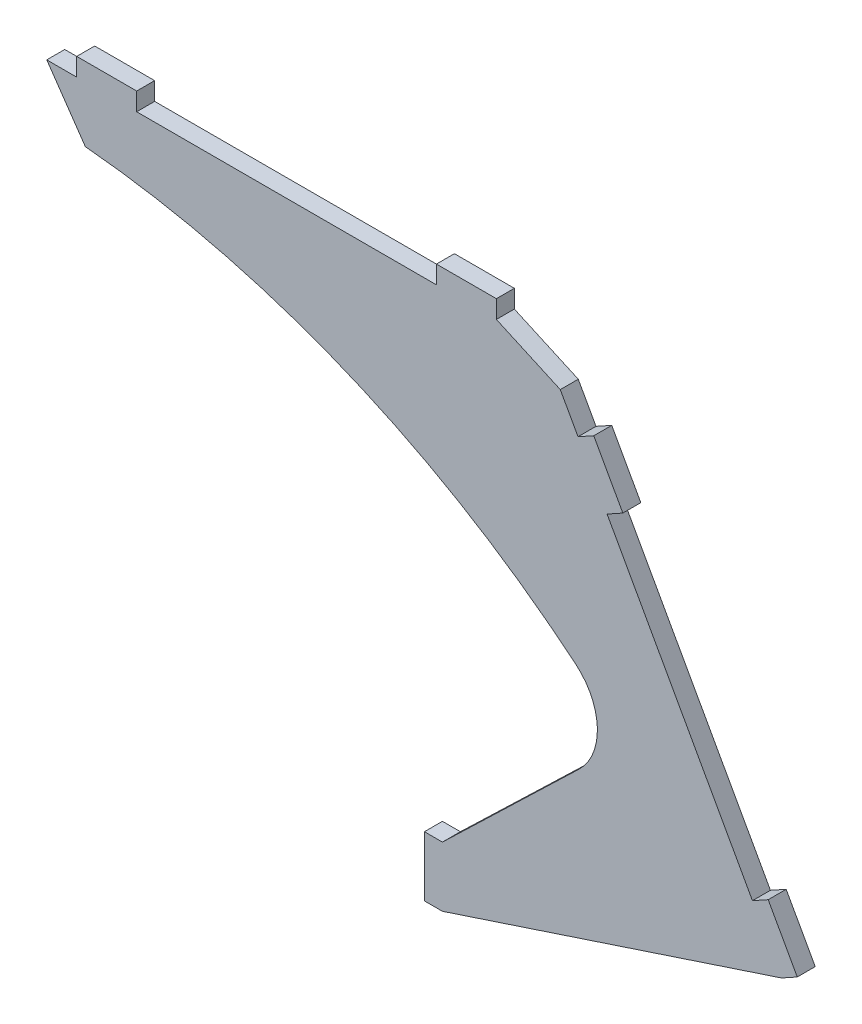
from build123d import *

# Parameters (mm, degrees)
DODANIE_WYCI_GNI_CIE1_DEPTH = 3


with BuildPart() as part:
    # Szkic1 → Dodanie-wyciągnięcie1 (new body)
    with BuildSketch(Plane.XY):
        with BuildLine():
            Line((19.554515356, 17.692448485), (42.339037775, 39.614393428))
            ThreePointArc((42.339037775, 39.614393428), (45.398922839, 47.188413696), (41.790456431, 54.516964018))
            ThreePointArc((41.790456431, 54.516964018), (3.452713921, 77.627149658), (-40.003066725, 88.3723025))
            Line((-40.003066725, 88.3723025), (-46.445484644, 97.692448485))
            Line((-46.445484644, 97.692448485), (-41.445484644, 97.692448485))
            Line((-41.445484644, 97.692448485), (-41.445484644, 100.692448485))
            Line((-41.445484644, 100.692448485), (-31.445484644, 100.692448485))
            Line((-31.445484644, 100.692448485), (-31.445484644, 97.692448485))
            Line((-31.445484644, 97.692448485), (18.554515356, 97.692448485))
            Line((18.554515356, 97.692448485), (18.554515356, 100.692448485))
            Line((18.554515356, 100.692448485), (28.554515356, 100.692448485))
            Line((28.554515356, 100.692448485), (28.554515356, 97.692448485))
            Line((28.554515356, 97.692448485), (39.21740232, 92.890521172))
            Line((39.21740232, 92.890521172), (42.174065347, 87.558833747))
            Line((42.174065347, 87.558833747), (44.797661434, 89.013737032))
            Line((44.797661434, 89.013737032), (49.647339051, 80.268416739))
            Line((49.647339051, 80.268416739), (47.023742963, 78.813513454))
            Line((47.023742963, 78.813513454), (71.272131047, 35.086911993))
            Line((71.272131047, 35.086911993), (73.895727134, 36.541815278))
            Line((73.895727134, 36.541815278), (78.745404751, 27.796494986))
            Line((78.745404751, 27.796494986), (76.121808663, 26.341591701))
            Line((76.121808663, 26.341591701), (19.554515356, 7.692448485))
            Line((19.554515356, 7.692448485), (16.554515356, 7.692448485))
            Line((16.554515356, 7.692448485), (16.554515356, 17.692448485))
            Line((16.554515356, 17.692448485), (19.554515356, 17.692448485))
        make_face()
    extrude(amount=DODANIE_WYCI_GNI_CIE1_DEPTH)


solid = part.part
